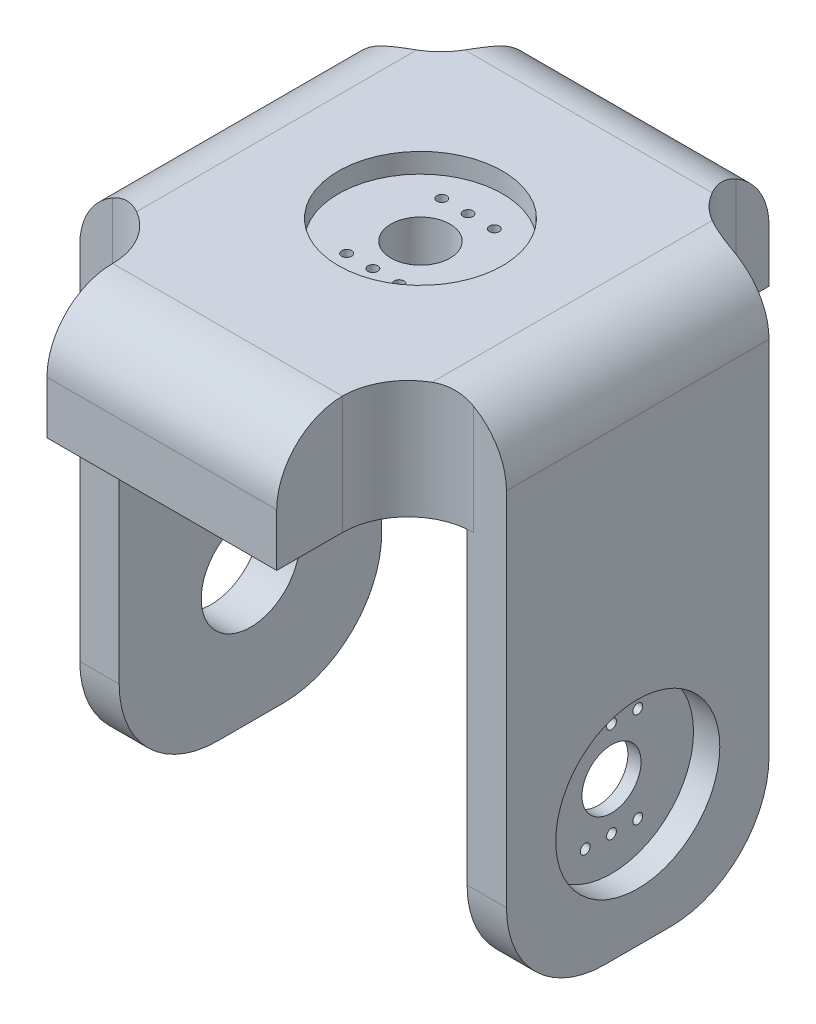
from build123d import *

# Parameters (mm, degrees)
BOSS_EXTRUDE1_DEPTH = 40
SKETCH2_R           = 12.5
CUT_EXTRUDE1_DEPTH  = 4
SKETCH3_R           = 0.75
SKETCH3_R_2         = 4.5
CUT_EXTRUDE2_DEPTH  = 4
SKETCH4_R           = 7.5
CUT_EXTRUDE3_DEPTH  = 14
SKETCH7_W           = 35
SKETCH7_H           = 15
SKETCH7_H_2         = 20
BOSS_EXTRUDE2_DEPTH = 18
SKETCH8_W           = 25
SKETCH8_H           = 55
CUT_EXTRUDE7_DEPTH  = 4
SKETCH9_W           = 20
SKETCH9_H           = 40
CUT_EXTRUDE8_DEPTH  = 3
SKETCH10_R          = 12.5
CUT_EXTRUDE9_DEPTH  = 3
SKETCH11_R          = 4.5
SKETCH11_R_2        = 0.75
CUT_EXTRUDE10_DEPTH = 13
FILLET1_R           = 15
FILLET2_R           = 10
FILLET3_R           = 10


with BuildPart() as part:
    # Sketch1 → Boss-Extrude1 (new body)
    with BuildSketch(Plane.XY):
        Polygon((-26.5, -40), (-26.5, 22), (26.5, 22), (26.5, -40), (32.5, -40), (32.5, 40), (-32.5, 40), (-32.5, -40), align=None)
    extrude(amount=BOSS_EXTRUDE1_DEPTH)

    # Sketch2 → Cut-Extrude1 (cut)
    with BuildSketch(Plane(origin=(32.5, 0, 0), x_dir=(0, 0, -1), z_dir=(1, 0, 0))):
        with Locations((-20, -20)):
            Circle(SKETCH2_R)
    extrude(amount=-CUT_EXTRUDE1_DEPTH, mode=Mode.SUBTRACT)

    # Sketch3 → Cut-Extrude2 (cut)
    with BuildSketch(Plane(origin=(28.5, 0, 0), x_dir=(0, 0, -1), z_dir=(1, 0, 0))):
        with Locations((-20, -12.75)):
            Circle(SKETCH3_R)
        with Locations((-16, -12.75)):
            Circle(SKETCH3_R)
        with Locations((-24, -12.75)):
            Circle(SKETCH3_R)
        with Locations((-20, -20)):
            Circle(SKETCH3_R_2)
        with Locations(Location((-16, -27.25, 0), (0, 0, 90))):
            Circle(SKETCH3_R)
        with Locations(Location((-20, -27.25, 0), (0, 0, 90))):
            Circle(SKETCH3_R)
        with Locations(Location((-24, -27.25, 0), (0, 0, 90))):
            Circle(SKETCH3_R)
    extrude(amount=-CUT_EXTRUDE2_DEPTH, mode=Mode.SUBTRACT)

    # Sketch4 → Cut-Extrude3 (cut)
    with BuildSketch(Plane(origin=(-26.5, 0, 0), x_dir=(0, 0, -1), z_dir=(1, 0, 0))):
        with Locations(Location((-20, -20, 0), (0, 0, 90))):
            Circle(SKETCH4_R)
    extrude(amount=-CUT_EXTRUDE3_DEPTH, mode=Mode.SUBTRACT)

    # Sketch7 → Boss-Extrude2 (add)
    with BuildSketch(Plane(origin=(0, 40, 0), x_dir=(1, 0, 0), z_dir=(0, 1, 0))):
        with Locations((0, 7.5)):
            Rectangle(SKETCH7_W, SKETCH7_H)
        with Locations((0, -50)):
            Rectangle(SKETCH7_W, SKETCH7_H_2)
    extrude(amount=-BOSS_EXTRUDE2_DEPTH)

    # Sketch8 → Cut-Extrude7 (cut)
    with BuildSketch(Plane.XZ.offset(-22)):
        with Locations((0, 29.5)):
            Rectangle(SKETCH8_W, SKETCH8_H)
    extrude(amount=-CUT_EXTRUDE7_DEPTH, mode=Mode.SUBTRACT)

    # Sketch9 → Cut-Extrude8 (cut)
    with BuildSketch(Plane.XZ.offset(-26)):
        with Locations((0, 29.5)):
            Rectangle(SKETCH9_W, SKETCH9_H)
    extrude(amount=-CUT_EXTRUDE8_DEPTH, mode=Mode.SUBTRACT)

    # Sketch10 → Cut-Extrude9 (cut)
    with BuildSketch(Plane(origin=(0, 40, 0), x_dir=(1, 0, 0), z_dir=(0, 1, 0))):
        with Locations(Location((0, -20.6, 0), (0, 0, 270))):
            Circle(SKETCH10_R)
    extrude(amount=-CUT_EXTRUDE9_DEPTH, mode=Mode.SUBTRACT)

    # Sketch11 → Cut-Extrude10 (cut)
    with BuildSketch(Plane(origin=(0, 37, 0), x_dir=(1, 0, 0), z_dir=(0, 1, 0))):
        with Locations(Location((0, -20.6, 0), (0, 0, 270))):
            Circle(SKETCH11_R)
        with Locations(Location((0, -13.35, 0), (0, 0, 270))):
            Circle(SKETCH11_R_2)
        with Locations(Location((4, -13.35, 0), (0, 0, 270))):
            Circle(SKETCH11_R_2)
        with Locations(Location((-4, -13.35, 0), (0, 0, 270))):
            Circle(SKETCH11_R_2)
        with Locations(Location((4, -27.85, 0), (0, 0, 90))):
            Circle(SKETCH11_R_2)
        with Locations(Location((0, -27.85, 0), (0, 0, 90))):
            Circle(SKETCH11_R_2)
        with Locations(Location((-4, -27.85, 0), (0, 0, 90))):
            Circle(SKETCH11_R_2)
    extrude(amount=-CUT_EXTRUDE10_DEPTH, mode=Mode.SUBTRACT)

    # Fillet1
    fillet1_edges = [part.edges().sort_by_distance(p)[0] for p in [
        (-29.5, -40, 0),
        (-29.5, -40, 40),
        (29.5, -40, 40),
        (29.5, -40, 0),
    ]]
    fillet(fillet1_edges, radius=FILLET1_R)

    # Fillet2
    # the kernel refuses this fillet: 10 mm, written as the material it adds along each edge
    with BuildSketch(Plane(origin=(-17.5, 40, 0), x_dir=(-1, 0, 0), z_dir=(0, -1, 0)), Plane(origin=(17.5, 40, 0), x_dir=(0, 0, -1), z_dir=(0, -1, 0))) as fillet2_piece_1:
        with BuildLine():
            CenterArc((FILLET2_R, FILLET2_R), FILLET2_R, 180, 90)
            Line((0, FILLET2_R), (0, 0))
            Line((0, 0), (FILLET2_R, 0))
        make_face()
    extrude(amount=18)
    with BuildSketch(Plane(origin=(-17.5, 40, 40), x_dir=(-1, 0, 0), z_dir=(0, -1, 0)), Plane(origin=(17.5, 40, 40), x_dir=(0, 0, 1), z_dir=(0, -1, 0))) as fillet2_piece_2:
        with BuildLine():
            CenterArc((FILLET2_R, -FILLET2_R), FILLET2_R, 90, 90)
            Line((0, -FILLET2_R), (0, 0))
            Line((0, 0), (FILLET2_R, 0))
        make_face()
    extrude(amount=18)

    # Fillet3
    fillet3_edges = [part.edges().sort_by_distance(p)[0] for p in [
        (0, 40, -15),
        (0, 40, 60),
        (32.5, 40, 20),
        (-32.5, 40, 20),
    ]]
    fillet(fillet3_edges, radius=FILLET3_R)


solid = part.part
